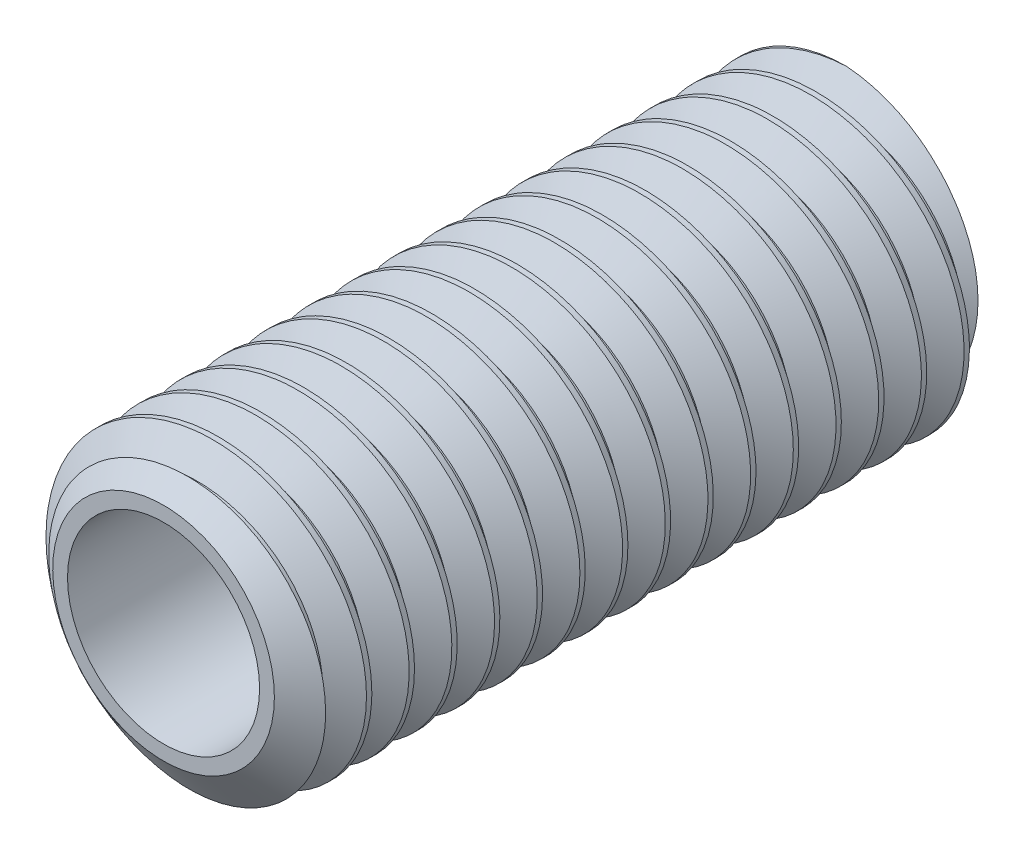
from build123d import *

# Parameters (mm, degrees)
SKETCH1_R          = 3.5
EXTRUDE1_DEPTH     = 16
CUT_SWEEP1_PITCH   = 1
SKETCH6_R          = 2.25
CUT_EXTRUDE1_DEPTH = 17.748134362


with BuildPart() as part:
    # Sketch1 → Extrude1 (new body)
    with BuildSketch(Plane.XY):
        Circle(SKETCH1_R)
    extrude(amount=-EXTRUDE1_DEPTH)

    # Cut-Sweep1: the profile of Sketch3 profile screwed along a right-hand helix of 17 turns, 6 arcs to a turn; built about Z, then put on its axis
    cut_sweep1_z = Axis((0, 0, 0), (0, 0, 1))
    cut_sweep1_corners = [(3.5003, 0, -0.875173205), (2.850480947, 0, -0.5), (2.850480947, 0, -0.375), (3.5003, 0, 0.000173205)]
    with BuildLine(mode=Mode.PRIVATE) as cut_sweep1_profile:
        Line(cut_sweep1_corners[0], cut_sweep1_corners[1])
        Line(cut_sweep1_corners[1], cut_sweep1_corners[2])
        Line(cut_sweep1_corners[2], cut_sweep1_corners[3])
        Line(cut_sweep1_corners[3], cut_sweep1_corners[0])
    cut_sweep1_cap = Face(cut_sweep1_profile.wire())
    cut_sweep1_turn_angles = [0, 30, 60, 90, 120, 150, 180, 210, 240, 270, 300, 330, 360]
    cut_sweep1_turn_weights = [1, 0.8660254037844387, 1, 0.8660254037844387, 1, 0.8660254037844387, 1, 0.8660254037844387, 1, 0.8660254037844387, 1, 0.8660254037844387, 1]
    cut_sweep1_turn_rails = [Edge.make_bspline([Vector(p[0], p[1], 0).rotate(cut_sweep1_z, cut_sweep1_turn_angles[k]) / cut_sweep1_turn_weights[k] + Vector(0, 0, p[2] + CUT_SWEEP1_PITCH * cut_sweep1_turn_angles[k] / 360) for k in range(13)], [0, 0, 0, 1, 1, 2, 2, 3, 3, 4, 4, 5, 5, 6, 6, 6], 2, cut_sweep1_turn_weights) for p in cut_sweep1_corners]
    cut_sweep1_turn_sides = [Face.make_surface_from_curves(cut_sweep1_turn_rails[p[0]], cut_sweep1_turn_rails[p[1]]) for p in [(0, 1), (1, 2), (2, 3), (3, 0)]]
    cut_sweep1 = Plane(origin=(0, 0, 0), x_dir=(0, 1, 0), z_dir=(0, 0, -1)) * Solid(Shell([*[p.moved(Location((0, 0, CUT_SWEEP1_PITCH * i))) for i in range(17) for p in cut_sweep1_turn_sides], cut_sweep1_cap, cut_sweep1_cap.rotate(cut_sweep1_z, 6120).moved(Location((0, 0, CUT_SWEEP1_PITCH * 6120 / 360)))]))
    add(cut_sweep1, mode=Mode.SUBTRACT)

    # Sketch4 → Cut-Revolve1 (revolve, cut)
    with BuildSketch(Plane(origin=(0, 0, 0), x_dir=(0, 0, -1), z_dir=(1, 0, 0)), mode=Mode.PRIVATE) as cut_revolve1_sk:
        Polygon((0.632650852, 3.5), (0, 2.596480947), (0, 3.5), align=None)
    revolve(cut_revolve1_sk.sketch.rotate(Axis((0, 0, 0), (0, 0, -1)), 244.349292568), axis=Axis((0, 0, 0), (0, 0, -1)), mode=Mode.SUBTRACT)

    # Sketch6 → Cut-Extrude1 (cut, through all)
    with BuildSketch(Plane(origin=(0, 0, -16), x_dir=(-1, 0, 0), z_dir=(0, 0, -1))):
        Circle(SKETCH6_R)
    extrude(amount=-CUT_EXTRUDE1_DEPTH, mode=Mode.SUBTRACT)


solid = part.part
